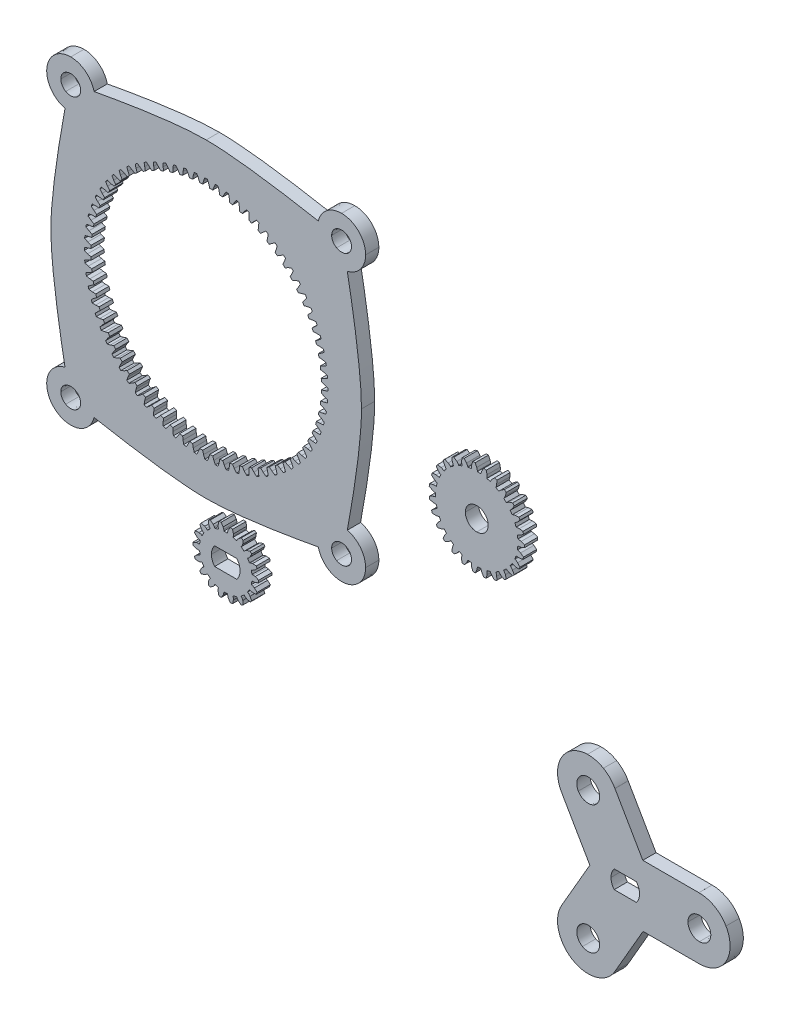
from build123d import *

# Parameters (mm, degrees)
BOSS_EXTRUDE1_DEPTH = 3.175
BOSS_EXTRUDE2_DEPTH = 3.175
BOSS_EXTRUDE3_DEPTH = 3.175
BOSS_EXTRUDE5_DEPTH = 3.175


with BuildPart() as part:
    # ring → Boss-Extrude1 (new body)
    with BuildSketch(Plane.XY):
        with BuildLine():
            add(Edge.make_bspline(
                [(6.50690376, 251.702783298), (5.89218576, 254.226925298), (3.61991476, 256.103686298), (0.90655676, 256.103686298)],
                knots=[0, 0, 0, 0, 1, 1, 1, 1], degree=3))
            add(Edge.make_bspline(
                [(0.90655676, 256.103686298), (-2.27867224, 256.103686298), (-4.86136024, 253.520997298), (-4.86136024, 250.335770298)],
                knots=[0, 0, 0, 0, 1, 1, 1, 1], degree=3))
            add(Edge.make_bspline(
                [(-4.86136024, 250.335770298), (-4.86136024, 247.620419298), (-2.98740724, 245.348149298), (-0.46045724, 244.735422298)],
                knots=[0, 0, 0, 0, 1, 1, 1, 1], degree=3))
            add(Edge.make_bspline(
                [(-0.46045724, 244.735422298), (-1.80349724, 237.525497298), (-3.86476324, 225.289078298), (-3.86476324, 217.827297298)],
                knots=[0, 0, 0, 0, 1, 1, 1, 1], degree=3))
            add(Edge.make_bspline(
                [(-3.86476324, 217.827297298), (-3.86476324, 210.369101298), (-1.81149624, 198.131265298), (-0.46927724, 190.919172298)],
                knots=[0, 0, 0, 0, 1, 1, 1, 1], degree=3))
            add(Edge.make_bspline(
                [(-0.46927724, 190.919172298), (-2.99232824, 190.303682298), (-4.86136024, 188.031410298), (-4.86136024, 185.318825298)],
                knots=[0, 0, 0, 0, 1, 1, 1, 1], degree=3))
            add(Edge.make_bspline(
                [(-4.86136024, 185.318825298), (-4.86136024, 182.133597298), (-2.27867224, 179.550908298), (0.90655676, 179.550908298)],
                knots=[0, 0, 0, 0, 1, 1, 1, 1], degree=3))
            add(Edge.make_bspline(
                [(0.90655676, 179.550908298), (3.61914076, 179.550908298), (5.89141476, 181.419939298), (6.50690376, 183.942992298)],
                knots=[0, 0, 0, 0, 1, 1, 1, 1], degree=3))
            add(Edge.make_bspline(
                [(6.50690376, 183.942992298), (13.71899576, 182.600771298), (25.95683376, 180.547506298), (33.41502876, 180.547506298)],
                knots=[0, 0, 0, 0, 1, 1, 1, 1], degree=3))
            add(Edge.make_bspline(
                [(33.41502876, 180.547506298), (40.87322476, 180.547506298), (53.11106076, 182.600771298), (60.32315376, 183.942992298)],
                knots=[0, 0, 0, 0, 1, 1, 1, 1], degree=3))
            add(Edge.make_bspline(
                [(60.32315376, 183.942992298), (60.93880476, 181.420168298), (63.21107976, 179.550908298), (65.92350076, 179.550908298)],
                knots=[0, 0, 0, 0, 1, 1, 1, 1], degree=3))
            add(Edge.make_bspline(
                [(65.92350076, 179.550908298), (69.10872876, 179.550908298), (71.69141776, 182.133597298), (71.69141776, 185.318825298)],
                knots=[0, 0, 0, 0, 1, 1, 1, 1], degree=3))
            add(Edge.make_bspline(
                [(71.69141776, 185.318825298), (71.69141776, 188.029126298), (69.81916976, 190.301413298), (67.29933476, 190.919172298)],
                knots=[0, 0, 0, 0, 1, 1, 1, 1], degree=3))
            add(Edge.make_bspline(
                [(67.29933476, 190.919172298), (68.64155476, 198.131265298), (70.69482076, 210.369101298), (70.69482076, 217.827297298)],
                knots=[0, 0, 0, 0, 1, 1, 1, 1], degree=3))
            add(Edge.make_bspline(
                [(70.69482076, 217.827297298), (70.69482076, 225.285494298), (68.64155476, 237.523329298), (67.29933476, 244.735422298)],
                knots=[0, 0, 0, 0, 1, 1, 1, 1], degree=3))
            add(Edge.make_bspline(
                [(67.29933476, 244.735422298), (69.81897476, 245.353320298), (71.69141776, 247.625606298), (71.69141776, 250.335770298)],
                knots=[0, 0, 0, 0, 1, 1, 1, 1], degree=3))
            add(Edge.make_bspline(
                [(71.69141776, 250.335770298), (71.69141776, 253.520997298), (69.10872876, 256.103686298), (65.92350076, 256.103686298)],
                knots=[0, 0, 0, 0, 1, 1, 1, 1], degree=3))
            add(Edge.make_bspline(
                [(65.92350076, 256.103686298), (63.21333776, 256.103686298), (60.94105076, 254.231243298), (60.32315376, 251.711603298)],
                knots=[0, 0, 0, 0, 1, 1, 1, 1], degree=3))
            add(Edge.make_bspline(
                [(60.32315376, 251.711603298), (53.11106076, 253.053824298), (40.87322476, 255.107089298), (33.41502876, 255.107089298)],
                knots=[0, 0, 0, 0, 1, 1, 1, 1], degree=3))
            add(Edge.make_bspline(
                [(33.41502876, 255.107089298), (25.95534276, 255.107089298), (13.71770176, 253.045859298), (6.50690376, 251.702783298)],
                knots=[0, 0, 0, 0, 1, 1, 1, 1], degree=3))
        make_face()
        with BuildLine():
            add(Edge.make_bspline(
                [(2.09740476, 187.316035298), (2.83557076, 186.903618298), (3.29029976, 186.141439298), (3.29029976, 185.316604298)],
                knots=[0, 0, 0, 0, 1, 1, 1, 1], degree=3))
            add(Edge.make_bspline(
                [(3.29029976, 185.316604298), (3.29029976, 184.491769298), (2.83557076, 183.729591298), (2.09740476, 183.317173298)],
                knots=[0, 0, 0, 0, 1, 1, 1, 1], degree=3))
            add(Edge.make_bspline(
                [(2.09740476, 183.317173298), (1.35923876, 182.904756298), (0.44977976, 182.904756298), (-0.28838624, 183.317173298)],
                knots=[0, 0, 0, 0, 1, 1, 1, 1], degree=3))
            add(Edge.make_bspline(
                [(-0.28838624, 183.317173298), (-1.02655224, 183.729591298), (-1.48128224, 184.491769298), (-1.48128224, 185.316604298)],
                knots=[0, 0, 0, 0, 1, 1, 1, 1], degree=3))
            add(Edge.make_bspline(
                [(-1.48128224, 185.316604298), (-1.48128224, 186.141439298), (-1.02655224, 186.903618298), (-0.28838624, 187.316035298)],
                knots=[0, 0, 0, 0, 1, 1, 1, 1], degree=3))
            add(Edge.make_bspline(
                [(-0.28838624, 187.316035298), (0.44977976, 187.728453298), (1.35923876, 187.728453298), (2.09740476, 187.316035298)],
                knots=[0, 0, 0, 0, 1, 1, 1, 1], degree=3))
        make_face(mode=Mode.SUBTRACT)
        Polygon((61.03852476, 219.389091298), (61.06956976, 218.676198298), (61.86656476, 218.446751298), (62.66214976, 218.139976298), (62.66214976, 217.511749298), (61.86656476, 217.204973298), (61.06956976, 216.975527298), (61.03852476, 216.262633298), (61.81237876, 215.964607298), (62.57804676, 215.589533298), (62.52329576, 214.963847298), (61.70400476, 214.727627298), (60.89035876, 214.568171298), (60.79722476, 213.860922298), (61.54200976, 213.496573298), (62.27211876, 213.056307298), (62.16318076, 212.437676298), (61.32639176, 212.273705298), (60.50173876, 212.185933298), (60.34736276, 211.489409298), (61.05771576, 211.061560298), (61.74662076, 210.559205298), (61.58406076, 209.952427298), (60.73626476, 209.862116298), (59.90709576, 209.846593298), (59.69260676, 209.166156298), (60.36288476, 208.677911298), (61.00550476, 208.117418298), (60.79073376, 207.527291298), (59.93814076, 207.511205298), (59.11094676, 207.567931298), (58.83775576, 206.908660298), (59.46316076, 206.363971298), (60.05441576, 205.749573298), (59.78912676, 205.180331298), (58.93822676, 205.238469298), (58.11893576, 205.367162298), (57.78958276, 204.734420298), (58.36503376, 204.137238298), (58.90069176, 203.473733298), (58.58657876, 202.929891298), (57.74414476, 203.061971298), (56.93924676, 203.261502298), (56.55598976, 202.659805298), (57.07697176, 202.014645298), (57.55279876, 201.306831298), (57.19240076, 200.792622298), (56.36464276, 200.997516298), (55.58034676, 201.266473298), (55.14600676, 200.700618298), (55.60885176, 200.012560298), (56.02117876, 199.266082298), (55.61731876, 198.784893298), (54.81072676, 199.061189298), (54.05267876, 199.397598298), (53.57064276, 198.871536298), (53.97196276, 198.145660298), (54.31740276, 197.366162298), (53.87346676, 196.922227298), (53.09396976, 197.267667298), (52.36809376, 197.668987298), (51.84203176, 197.186951298), (52.17844076, 196.428902298), (52.45473576, 195.622311298), (51.97354676, 195.218451298), (51.22706976, 195.630778298), (50.53901176, 196.093622298), (49.97315576, 195.659282298), (50.24211376, 194.874987298), (50.44700676, 194.047229298), (49.93279876, 193.686831298), (49.22498476, 194.162658298), (48.57982476, 194.683640298), (47.97812676, 194.300382298), (48.17765876, 193.495485298), (48.30973876, 192.653051298), (47.76589576, 192.338938298), (47.10239176, 192.874596298), (46.50520976, 193.450047298), (45.87246676, 193.120693298), (46.00116076, 192.301402298), (46.05929876, 191.450502298), (45.49005576, 191.185213298), (44.87565876, 191.776469298), (44.33096976, 192.401873298), (43.67169876, 192.128682298), (43.72842476, 191.301489298), (43.71233876, 190.448896298), (43.12221176, 190.234125298), (42.56171876, 190.876745298), (42.07347376, 191.547022298), (41.39303576, 191.332533298), (41.37751376, 190.503365298), (41.28720276, 189.655569298), (40.68042476, 189.493009298), (40.17806976, 190.181913298), (39.75022076, 190.892267298), (39.05369576, 190.737891298), (38.96592476, 189.913238298), (38.80195376, 189.076449298), (38.18332276, 188.967511298), (37.74305576, 189.697620298), (37.37870676, 190.442405298), (36.67145876, 190.349271298), (36.51200276, 189.535625298), (36.27578276, 188.716333298), (35.65009576, 188.661582298), (35.27502276, 189.427251298), (34.97699576, 190.201105298), (34.26410276, 190.170060298), (34.03465576, 189.373065298), (33.72788076, 188.577480298), (33.09965376, 188.577480298), (32.79287876, 189.373065298), (32.56343176, 190.170060298), (31.85053876, 190.201105298), (31.55251176, 189.427251298), (31.17743876, 188.661582298), (30.55175176, 188.716333298), (30.31553176, 189.535625298), (30.15607576, 190.349271298), (29.44882676, 190.442405298), (29.08447876, 189.697620298), (28.64421176, 188.967511298), (28.02558076, 189.076449298), (27.86160976, 189.913238298), (27.77383876, 190.737891298), (27.07731376, 190.892267298), (26.64946476, 190.181913298), (26.14710976, 189.493009298), (25.54033176, 189.655569298), (25.45002076, 190.503365298), (25.43449876, 191.332533298), (24.75406076, 191.547022298), (24.26581576, 190.876745298), (23.70532276, 190.234125298), (23.11519576, 190.448896298), (23.09910976, 191.301489298), (23.15583576, 192.128682298), (22.49656476, 192.401873298), (21.95187576, 191.776469298), (21.33747876, 191.185213298), (20.76823576, 191.450502298), (20.82637376, 192.301402298), (20.95506676, 193.120693298), (20.32232476, 193.450047298), (19.72514276, 192.874596298), (19.06163876, 192.338938298), (18.51779576, 192.653051298), (18.64987576, 193.495485298), (18.84940676, 194.300382298), (18.24770976, 194.683640298), (17.60254976, 194.162658298), (16.89473576, 193.686831298), (16.38052676, 194.047229298), (16.58542076, 194.874987298), (16.85437876, 195.659282298), (16.28852276, 196.093622298), (15.60046476, 195.630778298), (14.85398676, 195.218451298), (14.37279876, 195.622311298), (14.64909376, 196.428902298), (14.98550276, 197.186951298), (14.45944076, 197.668987298), (13.73356476, 197.267667298), (12.95406676, 196.922227298), (12.51013176, 197.366162298), (12.85557176, 198.145660298), (13.25689176, 198.871536298), (12.77485576, 199.397598298), (12.01680676, 199.061189298), (11.21021576, 198.784893298), (10.80635576, 199.266082298), (11.21868276, 200.012560298), (11.68152676, 200.700618298), (11.24718676, 201.266473298), (10.46289176, 200.997516298), (9.63513376, 200.792622298), (9.27473576, 201.306831298), (9.75056276, 202.014645298), (10.27154476, 202.659805298), (9.88828676, 203.261502298), (9.08338976, 203.061971298), (8.24095576, 202.929891298), (7.92684276, 203.473733298), (8.46250076, 204.137238298), (9.03795176, 204.734420298), (8.70859876, 205.367162298), (7.88930676, 205.238469298), (7.03840676, 205.180331298), (6.77311876, 205.749573298), (7.36437376, 206.363971298), (7.98977876, 206.908660298), (7.71658676, 207.567931298), (6.88939376, 207.511205298), (6.03680076, 207.527291298), (5.82202976, 208.117418298), (6.46464976, 208.677911298), (7.13492676, 209.166156298), (6.92043876, 209.846593298), (6.09126976, 209.862116298), (5.24347376, 209.952427298), (5.08091376, 210.559205298), (5.76981876, 211.061560298), (6.48017176, 211.489409298), (6.32579576, 212.185933298), (5.50114276, 212.273705298), (4.66435376, 212.437676298), (4.55541576, 213.056307298), (5.28552476, 213.496573298), (6.03030976, 213.860922298), (5.93717576, 214.568171298), (5.12352976, 214.727627298), (4.30423876, 214.963847298), (4.24948676, 215.589533298), (5.01515576, 215.964607298), (5.78900976, 216.262633298), (5.75796476, 216.975527298), (4.96096976, 217.204973298), (4.16538476, 217.511749298), (4.16538476, 218.139976298), (4.96096976, 218.446751298), (5.75796476, 218.676198298), (5.78900976, 219.389091298), (5.01515576, 219.687118298), (4.24948676, 220.062191298), (4.30423876, 220.687878298), (5.12352976, 220.924098298), (5.93717576, 221.083553298), (6.03030976, 221.790802298), (5.28552476, 222.155151298), (4.55541576, 222.595418298), (4.66435376, 223.214049298), (5.50114276, 223.378020298), (6.32579576, 223.465791298), (6.48017176, 224.162316298), (5.76981876, 224.590165298), (5.08091376, 225.092520298), (5.24347376, 225.699298298), (6.09126976, 225.789609298), (6.92043876, 225.805131298), (7.13492676, 226.485569298), (6.46464976, 226.973813298), (5.82202976, 227.534307298), (6.03680076, 228.124433298), (6.88939376, 228.140520298), (7.71658676, 228.083793298), (7.98977876, 228.743065298), (7.36437376, 229.287753298), (6.77311876, 229.902151298), (7.03840676, 230.471393298), (7.88930676, 230.413256298), (8.70859876, 230.284562298), (9.03795176, 230.917305298), (8.46250076, 231.514487298), (7.92684276, 232.177991298), (8.24095576, 232.721833298), (9.08338976, 232.589753298), (9.88828676, 232.390222298), (10.27154476, 232.991920298), (9.75056276, 233.637080298), (9.27473576, 234.344893298), (9.63513376, 234.859102298), (10.46289176, 234.654209298), (11.24718676, 234.385251298), (11.68152676, 234.951107298), (11.21868276, 235.639165298), (10.80635576, 236.385642298), (11.21021576, 236.866831298), (12.01680676, 236.590536298), (12.77485576, 236.254127298), (13.25689176, 236.780189298), (12.85557176, 237.506065298), (12.51013176, 238.285562298), (12.95406676, 238.729498298), (13.73356476, 238.384058298), (14.45944076, 237.982738298), (14.98550276, 238.464773298), (14.64909376, 239.222822298), (14.37279876, 240.029413298), (14.85398676, 240.433273298), (15.60046476, 240.020947298), (16.28852276, 239.558102298), (16.85437876, 239.992442298), (16.58542076, 240.776738298), (16.38052676, 241.604496298), (16.89473576, 241.964893298), (17.60254976, 241.489067298), (18.24770976, 240.968085298), (18.84940676, 241.351342298), (18.64987576, 242.156240298), (18.51779576, 242.998673298), (19.06163876, 243.312787298), (19.72514276, 242.777129298), (20.32232476, 242.201678298), (20.95506676, 242.531031298), (20.82637376, 243.350322298), (20.76823576, 244.201222298), (21.33747876, 244.466511298), (21.95187576, 243.875256298), (22.49656476, 243.249851298), (23.15583576, 243.523042298), (23.09910976, 244.350236298), (23.11519576, 245.202829298), (23.70532276, 245.417600298), (24.26581576, 244.774980298), (24.75406076, 244.104702298), (25.43449876, 244.319191298), (25.45002076, 245.148360298), (25.54033176, 245.996156298), (26.14710976, 246.158716298), (26.64946476, 245.469811298), (27.07731376, 244.759458298), (27.77383876, 244.913833298), (27.86160976, 245.738487298), (28.02558076, 246.575276298), (28.64421176, 246.684213298), (29.08447876, 245.954105298), (29.44882676, 245.209320298), (30.15607576, 245.302453298), (30.31553176, 246.116100298), (30.55175176, 246.935391298), (31.17743876, 246.990142298), (31.55251176, 246.224473298), (31.85053876, 245.450620298), (32.56343176, 245.481665298), (32.79287876, 246.278660298), (33.09965376, 247.074245298), (33.72788076, 247.074245298), (34.03465576, 246.278660298), (34.26410276, 245.481665298), (34.97699576, 245.450620298), (35.27502276, 246.224473298), (35.65009576, 246.990142298), (36.27578276, 246.935391298), (36.51200276, 246.116100298), (36.67145876, 245.302453298), (37.37870676, 245.209320298), (37.74305576, 245.954105298), (38.18332276, 246.684213298), (38.80195376, 246.575276298), (38.96592476, 245.738487298), (39.05369576, 244.913833298), (39.75022076, 244.759458298), (40.17806976, 245.469811298), (40.68042476, 246.158716298), (41.28720276, 245.996156298), (41.37751376, 245.148360298), (41.39303576, 244.319191298), (42.07347376, 244.104702298), (42.56171876, 244.774980298), (43.12221176, 245.417600298), (43.71233876, 245.202829298), (43.72842476, 244.350236298), (43.67169876, 243.523042298), (44.33096976, 243.249851298), (44.87565876, 243.875256298), (45.49005576, 244.466511298), (46.05929876, 244.201222298), (46.00116076, 243.350322298), (45.87246676, 242.531031298), (46.50520976, 242.201678298), (47.10239176, 242.777129298), (47.76589576, 243.312787298), (48.30973876, 242.998673298), (48.17765876, 242.156240298), (47.97812676, 241.351342298), (48.57982476, 240.968085298), (49.22498476, 241.489067298), (49.93279876, 241.964893298), (50.44700676, 241.604496298), (50.24211376, 240.776738298), (49.97315576, 239.992442298), (50.53901176, 239.558102298), (51.22706976, 240.020947298), (51.97354676, 240.433273298), (52.45473576, 240.029413298), (52.17844076, 239.222822298), (51.84203176, 238.464773298), (52.36809376, 237.982738298), (53.09396976, 238.384058298), (53.87346676, 238.729498298), (54.31740276, 238.285562298), (53.97196276, 237.506065298), (53.57064276, 236.780189298), (54.05267876, 236.254127298), (54.81072676, 236.590536298), (55.61731876, 236.866831298), (56.02117876, 236.385642298), (55.60885176, 235.639165298), (55.14600676, 234.951107298), (55.58034676, 234.385251298), (56.36464276, 234.654209298), (57.19240076, 234.859102298), (57.55279876, 234.344893298), (57.07697176, 233.637080298), (56.55598976, 232.991920298), (56.93924676, 232.390222298), (57.74414476, 232.589753298), (58.58657876, 232.721833298), (58.90069176, 232.177991298), (58.36503376, 231.514487298), (57.78958276, 230.917305298), (58.11893576, 230.284562298), (58.93822676, 230.413256298), (59.78912676, 230.471393298), (60.05441576, 229.902151298), (59.46316076, 229.287753298), (58.83775576, 228.743065298), (59.11094676, 228.083793298), (59.93814076, 228.140520298), (60.79073376, 228.124433298), (61.00550476, 227.534307298), (60.36288476, 226.973813298), (59.69260676, 226.485569298), (59.90709576, 225.805131298), (60.73626476, 225.789609298), (61.58406076, 225.699298298), (61.74662076, 225.092520298), (61.05771576, 224.590165298), (60.34736276, 224.162316298), (60.50173876, 223.465791298), (61.32639176, 223.378020298), (62.16318076, 223.214049298), (62.27211876, 222.595418298), (61.54200976, 222.155151298), (60.79722476, 221.790802298), (60.89035876, 221.083553298), (61.70400476, 220.924098298), (62.52329576, 220.687878298), (62.57804676, 220.062191298), (61.81237876, 219.687118298), align=None, mode=Mode.SUBTRACT)
        with BuildLine():
            add(Edge.make_bspline(
                [(67.11592076, 187.316035298), (67.85408676, 186.903618298), (68.30881676, 186.141439298), (68.30881676, 185.316604298)],
                knots=[0, 0, 0, 0, 1, 1, 1, 1], degree=3))
            add(Edge.make_bspline(
                [(68.30881676, 185.316604298), (68.30881676, 184.491769298), (67.85408676, 183.729591298), (67.11592076, 183.317173298)],
                knots=[0, 0, 0, 0, 1, 1, 1, 1], degree=3))
            add(Edge.make_bspline(
                [(67.11592076, 183.317173298), (66.37775476, 182.904756298), (65.46829676, 182.904756298), (64.73012976, 183.317173298)],
                knots=[0, 0, 0, 0, 1, 1, 1, 1], degree=3))
            add(Edge.make_bspline(
                [(64.73012976, 183.317173298), (63.99196376, 183.729591298), (63.53723476, 184.491769298), (63.53723476, 185.316604298)],
                knots=[0, 0, 0, 0, 1, 1, 1, 1], degree=3))
            add(Edge.make_bspline(
                [(63.53723476, 185.316604298), (63.53723476, 186.141439298), (63.99196376, 186.903618298), (64.73012976, 187.316035298)],
                knots=[0, 0, 0, 0, 1, 1, 1, 1], degree=3))
            add(Edge.make_bspline(
                [(64.73012976, 187.316035298), (65.46829676, 187.728453298), (66.37775476, 187.728453298), (67.11592076, 187.316035298)],
                knots=[0, 0, 0, 0, 1, 1, 1, 1], degree=3))
        make_face(mode=Mode.SUBTRACT)
        with BuildLine():
            add(Edge.make_bspline(
                [(2.09740476, 252.334553298), (2.83557076, 251.922135298), (3.29029976, 251.159956298), (3.29029976, 250.335122298)],
                knots=[0, 0, 0, 0, 1, 1, 1, 1], degree=3))
            add(Edge.make_bspline(
                [(3.29029976, 250.335122298), (3.29029976, 249.510287298), (2.83557076, 248.748108298), (2.09740476, 248.335690298)],
                knots=[0, 0, 0, 0, 1, 1, 1, 1], degree=3))
            add(Edge.make_bspline(
                [(2.09740476, 248.335690298), (1.35923776, 247.923273298), (0.44977976, 247.923273298), (-0.28838624, 248.335690298)],
                knots=[0, 0, 0, 0, 1, 1, 1, 1], degree=3))
            add(Edge.make_bspline(
                [(-0.28838624, 248.335690298), (-1.02655324, 248.748108298), (-1.48128224, 249.510287298), (-1.48128224, 250.335122298)],
                knots=[0, 0, 0, 0, 1, 1, 1, 1], degree=3))
            add(Edge.make_bspline(
                [(-1.48128224, 250.335122298), (-1.48128224, 251.159956298), (-1.02655324, 251.922135298), (-0.28838624, 252.334553298)],
                knots=[0, 0, 0, 0, 1, 1, 1, 1], degree=3))
            add(Edge.make_bspline(
                [(-0.28838624, 252.334553298), (0.44977976, 252.746970298), (1.35923776, 252.746970298), (2.09740476, 252.334553298)],
                knots=[0, 0, 0, 0, 1, 1, 1, 1], degree=3))
        make_face(mode=Mode.SUBTRACT)
        with BuildLine():
            add(Edge.make_bspline(
                [(67.11592076, 252.334551298), (67.85408676, 251.922134298), (68.30881676, 251.159955298), (68.30881676, 250.335120298)],
                knots=[0, 0, 0, 0, 1, 1, 1, 1], degree=3))
            add(Edge.make_bspline(
                [(68.30881676, 250.335120298), (68.30881676, 249.510285298), (67.85408676, 248.748106298), (67.11592076, 248.335689298)],
                knots=[0, 0, 0, 0, 1, 1, 1, 1], degree=3))
            add(Edge.make_bspline(
                [(67.11592076, 248.335689298), (66.37775476, 247.923272298), (65.46829676, 247.923272298), (64.73012976, 248.335689298)],
                knots=[0, 0, 0, 0, 1, 1, 1, 1], degree=3))
            add(Edge.make_bspline(
                [(64.73012976, 248.335689298), (63.99196376, 248.748106298), (63.53723476, 249.510285298), (63.53723476, 250.335120298)],
                knots=[0, 0, 0, 0, 1, 1, 1, 1], degree=3))
            add(Edge.make_bspline(
                [(63.53723476, 250.335120298), (63.53723476, 251.159955298), (63.99196376, 251.922134298), (64.73012976, 252.334551298)],
                knots=[0, 0, 0, 0, 1, 1, 1, 1], degree=3))
            add(Edge.make_bspline(
                [(64.73012976, 252.334551298), (65.46829676, 252.746969298), (66.37775476, 252.746969298), (67.11592076, 252.334551298)],
                knots=[0, 0, 0, 0, 1, 1, 1, 1], degree=3))
        make_face(mode=Mode.SUBTRACT)
    extrude(amount=BOSS_EXTRUDE1_DEPTH)


with BuildPart() as body_2:
    # sun → Boss-Extrude2 (new body)
    with BuildSketch(Plane.XY):
        Polygon((44.40620191, 170.247646781), (44.76575291, 170.284335781), (45.20263291, 170.222528781), (46.01571591, 169.872008781), (46.01571591, 169.332963781), (45.20263291, 168.982443781), (44.76575291, 168.920637781), (44.40620191, 168.957326781), (44.24731091, 168.056755781), (44.59783091, 167.968419781), (44.98729791, 167.760986781), (45.63132891, 167.153361781), (45.44703791, 166.647055781), (44.56311791, 166.595690781), (44.13159991, 166.686848781), (43.80619791, 166.844610781), (43.34899791, 166.052695781), (43.64815291, 165.849777781), (43.94307591, 165.521552781), (44.34044391, 164.730201781), (43.99415791, 164.317592781), (43.14579791, 164.571592781), (42.77157091, 164.804990781), (42.51982891, 165.064352781), (41.81907091, 164.476483781), (42.03101991, 164.183537781), (42.19583791, 163.774315781), (42.29856691, 162.894910781), (41.83205291, 162.625388781), (41.12169991, 163.154272781), (40.84991991, 163.501688781), (40.70203591, 163.831606781), (39.84266891, 163.518621781), (39.94144691, 163.170923781), (39.95640391, 162.730092781), (39.75207591, 161.868468781), (39.22149791, 161.775052781), (38.73494691, 162.514757781), (38.59835091, 162.934139781), (38.57210391, 163.294819781), (37.65770391, 163.294819781), (37.63145791, 162.934139781), (37.49486191, 162.514757781), (37.00831091, 161.775052781), (36.47773291, 161.868468781), (36.27340391, 162.730092781), (36.28836191, 163.170923781), (36.38713991, 163.518621781), (35.52777291, 163.831606781), (35.37988891, 163.501688781), (35.10810891, 163.154272781), (34.39775591, 162.625388781), (33.93124191, 162.894910781), (34.03397091, 163.774315781), (34.19878891, 164.183537781), (34.41073791, 164.476483781), (33.70997991, 165.064352781), (33.45823791, 164.804990781), (33.08401091, 164.571592781), (32.23565091, 164.317592781), (31.88936391, 164.730201781), (32.28673291, 165.521552781), (32.58165591, 165.849777781), (32.88081091, 166.052695781), (32.42361091, 166.844610781), (32.09820891, 166.686848781), (31.66669091, 166.595690781), (30.78277091, 166.647055781), (30.59847991, 167.153361781), (31.24251091, 167.760986781), (31.63197791, 167.968419781), (31.98249791, 168.056755781), (31.82360691, 168.957326781), (31.46405591, 168.920637781), (31.02717591, 168.982443781), (30.21409291, 169.332963781), (30.21409291, 169.872008781), (31.02717591, 170.222528781), (31.46405591, 170.284335781), (31.82360691, 170.247646781), (31.98249791, 171.148217781), (31.63197791, 171.236552781), (31.24251091, 171.443986781), (30.59847991, 172.051610781), (30.78277091, 172.557917781), (31.66669091, 172.609281781), (32.09820891, 172.518123781), (32.42361091, 172.360361781), (32.88081091, 173.152277781), (32.58165591, 173.355195781), (32.28673291, 173.683419781), (31.88936391, 174.474770781), (32.23565091, 174.887379781), (33.08401091, 174.633379781), (33.45823791, 174.399981781), (33.70997991, 174.140619781), (34.41073791, 174.728488781), (34.19878891, 175.021435781), (34.03397091, 175.430657781), (33.93124191, 176.310061781), (34.39775591, 176.579583781), (35.10810891, 176.050699781), (35.37988891, 175.703283781), (35.52777291, 175.373366781), (36.38713991, 175.686350781), (36.28836191, 176.034048781), (36.27340391, 176.474879781), (36.47773291, 177.336503781), (37.00831091, 177.429919781), (37.49486191, 176.690215781), (37.63145791, 176.270832781), (37.65770391, 175.910152781), (38.57210391, 175.910152781), (38.59835091, 176.270832781), (38.73494691, 176.690215781), (39.22149791, 177.429919781), (39.75207591, 177.336503781), (39.95640391, 176.474879781), (39.94144691, 176.034048781), (39.84266891, 175.686350781), (40.70203591, 175.373366781), (40.84991991, 175.703283781), (41.12169991, 176.050699781), (41.83205291, 176.579583781), (42.29856691, 176.310061781), (42.19583791, 175.430657781), (42.03101991, 175.021435781), (41.81907091, 174.728488781), (42.51982891, 174.140619781), (42.77157091, 174.399981781), (43.14579791, 174.633379781), (43.99415791, 174.887379781), (44.34044391, 174.474770781), (43.94307591, 173.683419781), (43.64815291, 173.355195781), (43.34899791, 173.152277781), (43.80619791, 172.360361781), (44.13159991, 172.518123781), (44.56311791, 172.609281781), (45.44703791, 172.557917781), (45.63132891, 172.051610781), (44.98729791, 171.443986781), (44.59783091, 171.236552781), (44.24731091, 171.148217781), align=None)
        with BuildLine():
            Line((35.44702391, 167.446136781), (40.78278491, 167.446136781))
            add(Edge.make_bspline(
                [(40.78278491, 167.446136781), (41.26046891, 168.035989781), (41.55007691, 168.788751781), (41.55007691, 169.606900781)],
                knots=[0, 0, 0, 0, 1, 1, 1, 1], degree=3))
            add(Edge.make_bspline(
                [(41.55007691, 169.606900781), (41.55007691, 170.425048781), (41.26046891, 171.168991781), (40.78278491, 171.758844781)],
                knots=[0, 0, 0, 0, 1, 1, 1, 1], degree=3))
            Line((40.78278491, 171.758844781), (35.44702391, 171.758844781))
            add(Edge.make_bspline(
                [(35.44702391, 171.758844781), (34.96933991, 171.168991781), (34.67973191, 170.425048781), (34.67973191, 169.606900781)],
                knots=[0, 0, 0, 0, 1, 1, 1, 1], degree=3))
            add(Edge.make_bspline(
                [(34.67973191, 169.606900781), (34.67973191, 168.788751781), (34.96933991, 168.035989781), (35.44702391, 167.446136781)],
                knots=[0, 0, 0, 0, 1, 1, 1, 1], degree=3))
        make_face(mode=Mode.SUBTRACT)
    extrude(amount=BOSS_EXTRUDE2_DEPTH)


with BuildPart() as body_3:
    # planet → Boss-Extrude3 (new body)
    with BuildSketch(Plane.XY):
        Polygon((108.229245681, 209.557872837), (108.375719681, 209.568597837), (109.027934681, 209.456837837), (109.833114681, 209.123814837), (109.833114681, 208.548646837), (109.027934681, 208.215623837), (108.375719681, 208.103863837), (108.229245681, 208.114588837), (108.129903681, 207.265381837), (108.274965681, 207.242239837), (108.884001681, 206.982877837), (109.590403681, 206.473466837), (109.457759681, 205.913819837), (108.597828681, 205.775248837), (107.937145681, 205.817017837), (107.797163681, 205.861326837), (107.504781681, 205.057839837), (107.640530681, 205.001677837), (108.173365681, 204.609106837), (108.743172681, 203.950399837), (108.484939681, 203.436472837), (107.616259681, 203.499972837), (106.983234681, 203.693012837), (106.857081681, 203.768366837), (106.387181681, 203.054061837), (106.506279681, 202.967983837), (106.934128681, 202.463088837), (107.336859681, 201.690646837), (106.967148681, 201.250097837), (106.136568681, 201.512563837), (105.565068681, 201.846150837), (105.459516681, 201.948597837), (104.837781681, 201.361857837), (104.933736681, 201.250661837), (105.233739681, 200.660817837), (105.447381681, 199.816126837), (104.986230681, 199.472943837), (104.238341681, 199.919701837), (103.759128681, 200.376054837), (103.680105681, 200.500232837), (102.939836681, 200.072666837), (103.007570681, 199.942279837), (103.163356681, 199.299094837), (103.176621681, 198.428157837), (102.648583681, 198.200403837), (102.024025681, 198.807463837), (101.663063681, 199.362312837), (101.614803681, 199.501166837), (100.795794681, 199.255914837), (100.831636681, 199.113392837), (100.835023681, 198.451581837), (100.646781681, 197.600963837), (100.080361681, 197.501057837), (99.612719681, 198.235963837), (99.389481681, 198.859110837), (99.374523681, 199.005301837), (98.521083681, 198.955630837), (98.523341681, 198.808592837), (98.373763681, 198.163997837), (97.994456681, 197.379701837), (97.420416681, 197.413003837), (97.134808681, 198.235963837), (97.061148681, 198.893823837), (97.080339681, 199.039450837), (96.238470681, 199.187899837), (96.206579681, 199.044530837), (95.912503681, 198.451581837), (95.362734681, 197.775941837), (94.811836681, 197.940759837), (94.723501681, 198.807463837), (94.803652681, 199.464477837), (94.855863681, 199.601919837), (94.071003681, 199.940586837), (94.006939681, 199.808223837), (93.584170681, 199.299094837), (92.893290681, 198.768517837), (92.395168681, 199.056101837), (92.509185681, 199.919701837), (92.738632681, 200.540590837), (92.821323681, 200.661946837), (92.135523681, 201.172486837), (92.042672681, 201.058468837), (91.513788681, 200.660817837), (90.719050681, 200.303806837), (90.300796681, 200.698352837), (90.610959681, 201.512563837), (90.977283681, 202.063743837), (91.085656681, 202.162803837), (90.536170681, 202.817841837), (90.419612681, 202.728377837), (89.813399681, 202.463088837), (88.957701681, 202.299117837), (88.641612681, 202.779459837), (89.131268681, 203.499972837), (89.614996681, 203.951810837), (89.743125681, 204.023494837), (89.359585681, 204.787470837), (89.225530681, 204.727357837), (88.574161681, 204.609106837), (87.704070681, 204.646641837), (87.507361681, 205.187097837), (88.149699681, 205.775248837), (88.724585681, 206.103472837), (88.865979681, 206.143548837), (88.668705681, 206.975539837), (88.524490681, 206.947881837), (87.863525681, 206.982877837), (87.025325681, 207.220226837), (86.958721681, 207.791443837), (87.719592681, 208.215623837), (88.354592681, 208.402454837), (88.501348681, 208.408663837), (88.501348681, 209.263797837), (88.354592681, 209.270006837), (87.719592681, 209.456837837), (86.958721681, 209.881017837), (87.025325681, 210.452234837), (87.863525681, 210.689583837), (88.524490681, 210.724579837), (88.668705681, 210.696921837), (88.865979681, 211.528912837), (88.724585681, 211.568988837), (88.149699681, 211.897212837), (87.507361681, 212.485363837), (87.704070681, 213.025819837), (88.574161681, 213.063354837), (89.225530681, 212.945103837), (89.359585681, 212.884990837), (89.743125681, 213.648966837), (89.614996681, 213.720650837), (89.131268681, 214.172488837), (88.641612681, 214.893001837), (88.957701681, 215.373343837), (89.813399681, 215.209372837), (90.419612681, 214.944083837), (90.536170681, 214.854619837), (91.085656681, 215.509657837), (90.977283681, 215.608717837), (90.610959681, 216.159897837), (90.300796681, 216.974108837), (90.719050681, 217.368654837), (91.513788681, 217.011643837), (92.042672681, 216.613992837), (92.135523681, 216.499974837), (92.821323681, 217.010514837), (92.738632681, 217.131870837), (92.509185681, 217.752759837), (92.395168681, 218.616359837), (92.893290681, 218.903943837), (93.584170681, 218.373366837), (94.006939681, 217.864237837), (94.071003681, 217.731874837), (94.855863681, 218.070541837), (94.803652681, 218.207983837), (94.723501681, 218.864997837), (94.811836681, 219.731701837), (95.362734681, 219.896519837), (95.912503681, 219.220879837), (96.206579681, 218.627930837), (96.238470681, 218.484561837), (97.080339681, 218.633010837), (97.061148681, 218.778637837), (97.134808681, 219.436497837), (97.420416681, 220.259457837), (97.994456681, 220.292759837), (98.373763681, 219.508463837), (98.523341681, 218.863868837), (98.521083681, 218.716830837), (99.374523681, 218.667159837), (99.389481681, 218.813350837), (99.612719681, 219.436497837), (100.080361681, 220.171403837), (100.646781681, 220.071497837), (100.835023681, 219.220879837), (100.831636681, 218.559068837), (100.795794681, 218.416546837), (101.614803681, 218.171294837), (101.663063681, 218.310148837), (102.024025681, 218.864997837), (102.648583681, 219.472057837), (103.176621681, 219.244303837), (103.163356681, 218.373366837), (103.007570681, 217.730181837), (102.939836681, 217.599794837), (103.680105681, 217.172228837), (103.759128681, 217.296406837), (104.238341681, 217.752759837), (104.986230681, 218.199517837), (105.447381681, 217.856334837), (105.233739681, 217.011643837), (104.933736681, 216.421799837), (104.837781681, 216.310603837), (105.459516681, 215.723863837), (105.565068681, 215.826310837), (106.136568681, 216.159897837), (106.967148681, 216.422363837), (107.336859681, 215.981814837), (106.934128681, 215.209372837), (106.506279681, 214.704477837), (106.387181681, 214.618399837), (106.857081681, 213.904094837), (106.983234681, 213.979448837), (107.616259681, 214.172488837), (108.484939681, 214.235988837), (108.743172681, 213.722061837), (108.173365681, 213.063354837), (107.640530681, 212.670783837), (107.504781681, 212.614621837), (107.797163681, 211.811134837), (107.937145681, 211.855443837), (108.597828681, 211.897212837), (109.457759681, 211.758641837), (109.590403681, 211.198994837), (108.884001681, 210.689583837), (108.274965681, 210.430221837), (108.129903681, 210.407079837), align=None)
        with BuildLine():
            add(Edge.make_bspline(
                [(101.117463681, 208.836234837), (101.117463681, 207.320930837), (99.889065681, 206.092535837), (98.373763681, 206.092535837)],
                knots=[0, 0, 0, 0, 1, 1, 1, 1], degree=3))
            add(Edge.make_bspline(
                [(98.373763681, 206.092535837), (96.858458681, 206.092535837), (95.630064681, 207.320930837), (95.630064681, 208.836234837)],
                knots=[0, 0, 0, 0, 1, 1, 1, 1], degree=3))
            add(Edge.make_bspline(
                [(95.630064681, 208.836234837), (95.630064681, 210.351536837), (96.858458681, 211.579934837), (98.373763681, 211.579934837)],
                knots=[0, 0, 0, 0, 1, 1, 1, 1], degree=3))
            add(Edge.make_bspline(
                [(98.373763681, 211.579934837), (99.889065681, 211.579934837), (101.117463681, 210.351536837), (101.117463681, 208.836234837)],
                knots=[0, 0, 0, 0, 1, 1, 1, 1], degree=3))
        make_face(mode=Mode.SUBTRACT)
    extrude(amount=BOSS_EXTRUDE3_DEPTH)


with BuildPart() as body_4:
    # carrier → Boss-Extrude5 (new body)
    with BuildSketch(Plane.XY):
        with BuildLine():
            add(Edge.make_bspline(
                [(118.748455038, 169.468215691), (117.360345038, 167.063938691), (117.483199038, 164.211290691), (118.819010038, 161.989326691)],
                knots=[0, 0, 0, 0, 1, 1, 1, 1], degree=3))
            Line((118.819010038, 161.989326691), (118.810191038, 161.980520691))
            Line((118.810191038, 161.980520691), (125.512969038, 150.382951691))
            Line((125.512969038, 150.382951691), (118.819010038, 138.794201691))
            Line((118.819010038, 138.794201691), (118.810191038, 138.776562691))
            add(Edge.make_bspline(
                [(118.810191038, 138.776562691), (118.138894038, 137.665721691), (117.760677038, 136.367990691), (117.760677038, 134.975382691)],
                knots=[0, 0, 0, 0, 1, 1, 1, 1], degree=3))
            add(Edge.make_bspline(
                [(117.760677038, 134.975382691), (117.760675038, 130.905661691), (121.064010038, 127.602323691), (125.133733038, 127.602326691)],
                knots=[0, 0, 0, 0, 1, 1, 1, 1], degree=3))
            add(Edge.make_bspline(
                [(125.133733038, 127.602326691), (127.909953038, 127.602326691), (130.315556038, 129.144498691), (131.571927038, 131.412326691)],
                knots=[0, 0, 0, 0, 1, 1, 1, 1], degree=3))
            Line((131.571927038, 131.412326691), (131.580732038, 131.403521691))
            Line((131.580732038, 131.403521691), (138.283510038, 143.009910691))
            Line((138.283510038, 143.009910691), (151.653788038, 143.009910691))
            Line((151.653788038, 143.009910691), (151.671427038, 143.009910691))
            add(Edge.make_bspline(
                [(151.671427038, 143.009910691), (152.969090038, 142.983973691), (154.284212038, 143.301383691), (155.490246038, 143.997687691)],
                knots=[0, 0, 0, 0, 1, 1, 1, 1], degree=3))
            add(Edge.make_bspline(
                [(155.490246038, 143.997687691), (159.014728038, 146.032549691), (160.223858038, 150.545012691), (158.188996038, 154.069493691)],
                knots=[0, 0, 0, 0, 1, 1, 1, 1], degree=3))
            add(Edge.make_bspline(
                [(158.188996038, 154.069493691), (156.800886038, 156.473769691), (154.263610038, 157.793065691), (151.671427038, 157.747201691)],
                knots=[0, 0, 0, 0, 1, 1, 1, 1], degree=3))
            Line((151.671427038, 157.747201691), (151.671427038, 157.754849091))
            Line((151.671427038, 157.754849091), (138.224971754, 157.754849091))
            Line((138.224971754, 157.754849091), (131.539832754, 169.334779091))
            Line((131.539832754, 169.334779091), (131.531027754, 169.352418091))
            add(Edge.make_bspline(
                [(131.531027754, 169.352418091), (130.904660754, 170.489198091), (129.976575754, 171.469517091), (128.770540754, 172.165821091)],
                knots=[0, 0, 0, 0, 1, 1, 1, 1], degree=3))
            add(Edge.make_bspline(
                [(128.770540754, 172.165821091), (127.565708199, 172.861433534), (126.244241887, 173.179504317), (124.946928377, 173.154056045)],
                knots=[0, 0, 0, 0, 0.994463703, 0.994463703, 0.994463703, 0.994463703], degree=3))
            add(Edge.make_bspline(
                [(124.946928377, 173.154056045), (122.467005204, 173.088633853), (120.078815068, 171.772470761), (118.748455038, 169.468215691)],
                knots=[0.003756223, 0.003756223, 0.003756223, 0.003756223, 1, 1, 1, 1], degree=3))
        make_face()
        with BuildLine():
            add(Edge.make_bspline(
                [(127.49809, 133.604715), (126.740439, 132.292425), (125.062417, 131.8428), (123.750127, 132.600451)],
                knots=[0, 0, 0, 0, 1, 1, 1, 1], degree=3))
            add(Edge.make_bspline(
                [(123.750127, 132.600451), (122.437834, 133.358103), (121.988212, 135.036124), (122.745863, 136.348414)],
                knots=[0, 0, 0, 0, 1, 1, 1, 1], degree=3))
            add(Edge.make_bspline(
                [(122.745863, 136.348414), (123.503515, 137.660706), (125.181534, 138.11033), (126.493826, 137.352678)],
                knots=[0, 0, 0, 0, 1, 1, 1, 1], degree=3))
            add(Edge.make_bspline(
                [(126.493826, 137.352678), (127.806116, 136.595027), (128.255742, 134.917007), (127.49809, 133.604715)],
                knots=[0, 0, 0, 0, 1, 1, 1, 1], degree=3))
        make_face(mode=Mode.SUBTRACT)
        with BuildLine():
            Line((136.683962, 148.224924), (131.348201, 148.224924))
            add(Edge.make_bspline(
                [(130.580909, 150.385688), (130.580909, 149.56754), (130.870517, 148.814777), (131.348201, 148.224924)],
                knots=[0, 0, 0, 0, 1, 1, 1, 1], degree=3))
            add(Edge.make_bspline(
                [(131.348201, 152.537633), (130.870517, 151.94778), (130.580909, 151.203836), (130.580909, 150.385688)],
                knots=[0, 0, 0, 0, 1, 1, 1, 1], degree=3))
            Line((131.348201, 152.537633), (136.683962, 152.537633))
            add(Edge.make_bspline(
                [(137.451253, 150.385688), (137.451253, 151.203836), (137.161645, 151.94778), (136.683962, 152.537633)],
                knots=[0, 0, 0, 0, 1, 1, 1, 1], degree=3))
            add(Edge.make_bspline(
                [(136.683962, 148.224924), (137.161645, 148.814777), (137.451253, 149.56754), (137.451253, 150.385688)],
                knots=[0, 0, 0, 0, 1, 1, 1, 1], degree=3))
        make_face(mode=Mode.SUBTRACT)
        with BuildLine():
            add(Edge.make_bspline(
                [(151.803377, 153.124973), (153.318678, 153.124973), (154.547076, 151.896576), (154.547076, 150.381274)],
                knots=[0, 0, 0, 0, 1, 1, 1, 1], degree=3))
            add(Edge.make_bspline(
                [(154.547076, 150.381274), (154.547076, 148.865969), (153.318678, 147.637574), (151.803377, 147.637574)],
                knots=[0, 0, 0, 0, 1, 1, 1, 1], degree=3))
            add(Edge.make_bspline(
                [(151.803377, 147.637574), (150.288072, 147.637574), (149.059677, 148.865969), (149.059677, 150.381274)],
                knots=[0, 0, 0, 0, 1, 1, 1, 1], degree=3))
            add(Edge.make_bspline(
                [(149.059677, 150.381274), (149.059677, 151.896576), (150.288072, 153.124973), (151.803377, 153.124973)],
                knots=[0, 0, 0, 0, 1, 1, 1, 1], degree=3))
        make_face(mode=Mode.SUBTRACT)
        with BuildLine():
            add(Edge.make_bspline(
                [(122.74586, 164.414132), (121.988209, 165.726422), (122.437834, 167.404444), (123.750123, 168.162095)],
                knots=[0, 0, 0, 0, 1, 1, 1, 1], degree=3))
            add(Edge.make_bspline(
                [(123.750123, 168.162095), (125.062416, 168.919747), (126.740436, 168.470121), (127.498087, 167.157831)],
                knots=[0, 0, 0, 0, 1, 1, 1, 1], degree=3))
            add(Edge.make_bspline(
                [(127.498087, 167.157831), (128.255739, 165.845539), (127.806115, 164.16752), (126.493823, 163.409868)],
                knots=[0, 0, 0, 0, 1, 1, 1, 1], degree=3))
            add(Edge.make_bspline(
                [(126.493823, 163.409868), (125.181533, 162.652217), (123.503512, 163.101839), (122.74586, 164.414132)],
                knots=[0, 0, 0, 0, 1, 1, 1, 1], degree=3))
        make_face(mode=Mode.SUBTRACT)
    extrude(amount=BOSS_EXTRUDE5_DEPTH)


solid = Compound([part.part, body_2.part, body_3.part, body_4.part])
